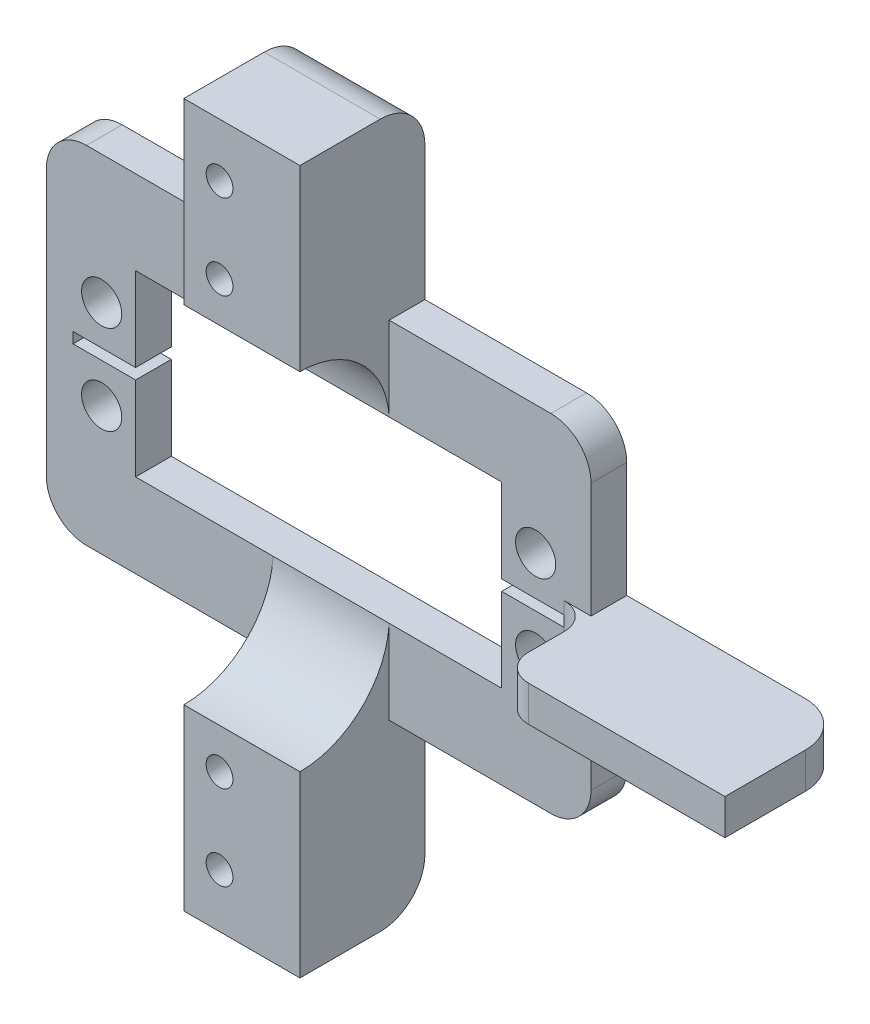
from build123d import *

# Parameters (mm, degrees)
ESBO_O1_R                     = 2.25
RESSALTO_EXTRUS_O1_DEPTH      = 4
RESSALTO_EXTRUS_O2_DEPTH      = 10
RESSALTO_EXTRUS_O2_DEPTH_BACK = 4
ESBO_O2_W                     = 10
ESBO_O2_H                     = 20
ESBO_O2_R                     = 1.5
ESBO_O2_W_2                   = 3
FILETE1_R                     = 3
FILETE2_R                     = 3
FILETE3_R                     = 10
FILETE4_R                     = 10
FILETE6_R                     = 5
FILETE7_R                     = 5
FILETE8_R                     = 5


# Some blends are built 0.0001 mm under size
with BuildPart() as part:
    # Esboço1 → Ressalto-extrusão1 (new body)
    with BuildSketch(Plane.XY):
        with BuildLine():
            Line((30, 15.55), (30, 30.45))
            Line((30, 30.45), (30, 45.35))
            ThreePointArc((30, 45.35), (28.681980515, 48.531980515), (25.5, 49.85))
            Line((25.5, 49.85), (24.5, 49.85))
            Line((24.5, 49.85), (-26.5, 49.85))
            ThreePointArc((-26.5, 49.85), (-29.681980515, 48.531980515), (-31, 45.35))
            Line((-31, 45.35), (-31, 30.45))
            Line((-31, 30.45), (-31, 15.55))
            ThreePointArc((-31, 15.55), (-29.681980515, 12.368019485), (-26.5, 11.05))
            Line((-26.5, 11.05), (25.5, 11.05))
            ThreePointArc((25.5, 11.05), (28.681980515, 12.368019485), (30, 15.55))
        make_face()
        with Locations((-24.8, 25.45)):
            Circle(ESBO_O1_R, mode=Mode.SUBTRACT)
        with Locations((23.8, 25.45)):
            Circle(ESBO_O1_R, mode=Mode.SUBTRACT)
        with Locations((-24.8, 35.45)):
            Circle(ESBO_O1_R, mode=Mode.SUBTRACT)
        Polygon((27, 31.05), (27, 30.45), (27, 29.85), (20, 29.85), (20, 20.45), (-21, 20.45), (-21, 29.85), (-28, 29.85), (-28, 31.05), (-21, 31.05), (-21, 40.45), (20, 40.45), (20, 31.05), align=None, mode=Mode.SUBTRACT)
        with Locations((23.8, 35.45)):
            Circle(ESBO_O1_R, mode=Mode.SUBTRACT)
    extrude(amount=RESSALTO_EXTRUS_O1_DEPTH)

    # Esboço2 → Ressalto-extrusão2 (add, two sides: drawn at the far end of the back side and taken through both)
    # profile 1 of 5: a face of its own
    with BuildSketch(Plane.XY.offset(4).offset(-RESSALTO_EXTRUS_O2_DEPTH_BACK)):
        with Locations((-0.6, 59.85)):
            Rectangle(ESBO_O2_W, ESBO_O2_H)
        with Locations((-1.6, 54.35)):
            Circle(ESBO_O2_R, mode=Mode.SUBTRACT)
        with Locations((-1.6, 63.85)):
            Circle(ESBO_O2_R, mode=Mode.SUBTRACT)
    # profile 2 of 5: a face of its own
    with BuildSketch(Plane.XY.offset(4).offset(-RESSALTO_EXTRUS_O2_DEPTH_BACK)):
        with Locations((5.9, 59.85)):
            Rectangle(ESBO_O2_W_2, ESBO_O2_H)
    # profile 3 of 5: a face of its own
    with BuildSketch(Plane.XY.offset(4).offset(-RESSALTO_EXTRUS_O2_DEPTH_BACK)):
        Polygon((30, 32.45), (30, 30.45), (30, 28.45), (55, 28.45), (55, 32.45), align=None)
    # profile 4 of 5: a face of its own
    with BuildSketch(Plane.XY.offset(4).offset(-RESSALTO_EXTRUS_O2_DEPTH_BACK)):
        with Locations((-0.6, 1.05)):
            Rectangle(ESBO_O2_W, ESBO_O2_H)
        with Locations((-1.6, -2.95)):
            Circle(ESBO_O2_R, mode=Mode.SUBTRACT)
        with Locations((-1.6, 6.55)):
            Circle(ESBO_O2_R, mode=Mode.SUBTRACT)
    # profile 5 of 5: a face of its own
    with BuildSketch(Plane.XY.offset(4).offset(-RESSALTO_EXTRUS_O2_DEPTH_BACK)):
        with Locations((5.9, 1.05)):
            Rectangle(ESBO_O2_W_2, ESBO_O2_H)
    extrude(amount=RESSALTO_EXTRUS_O2_DEPTH + RESSALTO_EXTRUS_O2_DEPTH_BACK)

    # Filete1
    filete1_edges = [part.edges().sort_by_distance(p)[0] for p in [
        (30, 30.45, 4),
    ]]
    fillet(filete1_edges, radius=FILETE1_R - 0.0001)  # a hair under: the kernel refuses the full size

    # Filete2
    filete2_edges = [part.edges().sort_by_distance(p)[0] for p in [
        (30, 30.45, 14),
    ]]
    fillet(filete2_edges, radius=FILETE2_R)

    # Filete3
    # the kernel refuses this fillet: 10 mm, written as the material it adds along each edge
    with BuildSketch(Plane(origin=(-5.6, 11.05, 4), x_dir=(0, 1, 0), z_dir=(1, 0, 0))) as filete3_piece_1:
        with BuildLine():
            CenterArc((10, 9.981983771), FILETE3_R, 180, 86.560187232)
            Line((0, 9.981983771), (0, 0))
            Line((0, 0), (9.4, 0))
        make_face()
    extrude(amount=13)

    # Filete4
    # the kernel refuses this fillet: 10 mm, written as the material it adds along each edge
    with BuildSketch(Plane(origin=(-5.6, 49.85, 4), x_dir=(0, -1, 0), z_dir=(1, 0, 0))) as filete4_piece_1:
        with BuildLine():
            CenterArc((10, -9.981983771), FILETE4_R, 93.439812768, 86.560187232)
            Line((0, -9.981983771), (0, 0))
            Line((0, 0), (9.4, 0))
        make_face()
    extrude(amount=13)

    # Filete6
    # the kernel refuses this fillet: 5 mm, written as the material it takes off along each edge
    with BuildSketch(Plane(origin=(-18.1, 69.85, 0), x_dir=(0, -1, 0), z_dir=(1, 0, 0))) as filete6_piece_1:
        with BuildLine():
            CenterArc((FILETE6_R, -FILETE6_R), FILETE6_R, 90, 90)
            Line((0, -FILETE6_R), (0, 0))
            Line((0, 0), (FILETE6_R, 0))
        make_face()
    extrude(amount=38, mode=Mode.SUBTRACT)

    # Filete7
    # the kernel refuses this fillet: 5 mm, written as the material it takes off along each edge
    with BuildSketch(Plane(origin=(19.9, -8.95, 0), x_dir=(0, 1, 0), z_dir=(-1, 0, 0))) as filete7_piece_1:
        with BuildLine():
            CenterArc((FILETE7_R, -FILETE7_R), FILETE7_R, 90, 90)
            Line((0, -FILETE7_R), (0, 0))
            Line((0, 0), (FILETE7_R, 0))
        make_face()
    extrude(amount=38, mode=Mode.SUBTRACT)

    # Filete8
    filete8_edges = [part.edges().sort_by_distance(p)[0] for p in [
        (55, 30.45, 0),
    ]]
    fillet(filete8_edges, radius=FILETE8_R)


solid = part.part
